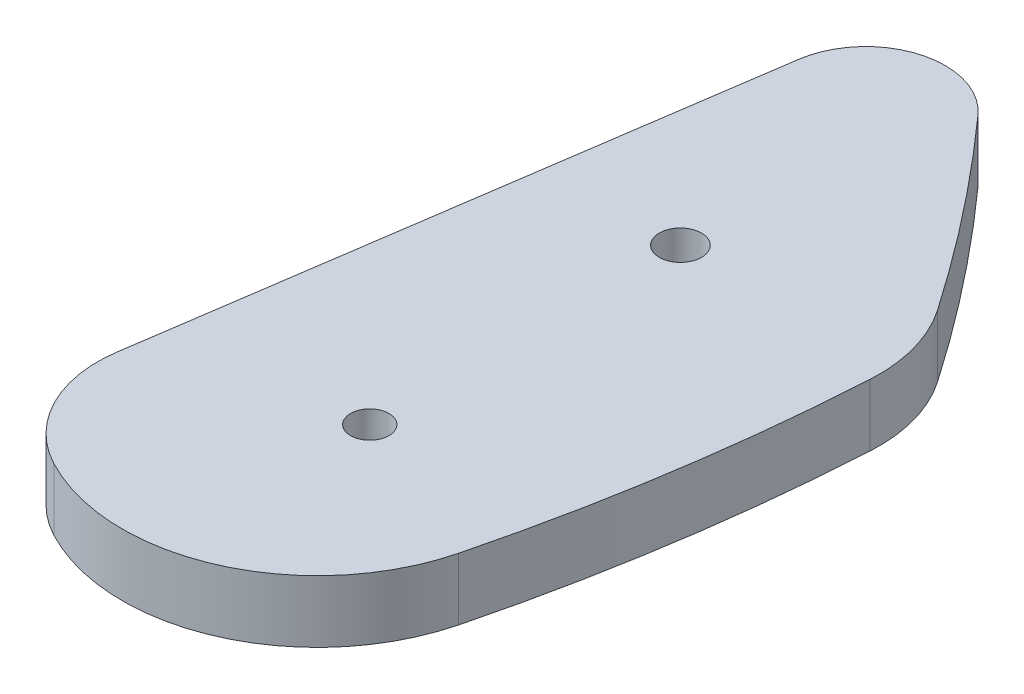
from build123d import *

# Parameters (mm, degrees)
SKETCH1_R           = 1.7
SKETCH1_R_2         = 1.546055016
BOSS_EXTRUDE2_DEPTH = 5


with BuildPart() as part:
    # Sketch1 → Boss-Extrude2 (new body)
    with BuildSketch(Plane(origin=(0, 0, 0), x_dir=(1, 0, 0), z_dir=(0, 1, 0))):
        with BuildLine():
            Line((-43.194615771, 148.715173848), (-50.225239518, 100.870673101))
            ThreePointArc((-50.225239518, 100.870673101), (-49.249154262, 94.891853376), (-45.000372743, 90.573649661))
            ThreePointArc((-45.000372743, 90.573649661), (-31.29378116, 90.112244527), (-22.456551163, 100.599709115))
            ThreePointArc((-22.456551163, 100.599709115), (-19.558480324, 114.843106453), (-18.020623668, 129.29676271))
            ThreePointArc((-18.020623668, 129.29676271), (-18.441772746, 133.226047543), (-20.116399197, 136.805470974))
            ThreePointArc((-20.116399197, 136.805470974), (-25.866377757, 144.615905974), (-32.098124488, 152.047627243))
            ThreePointArc((-32.098124488, 152.047627243), (-38.706331156, 153.910886754), (-43.194615771, 148.715173848))
        make_face()
        with Locations((-35, 131)):
            Circle(SKETCH1_R, mode=Mode.SUBTRACT)
        with Locations((-35, 106)):
            Circle(SKETCH1_R_2, mode=Mode.SUBTRACT)
    extrude(amount=BOSS_EXTRUDE2_DEPTH)


solid = part.part
